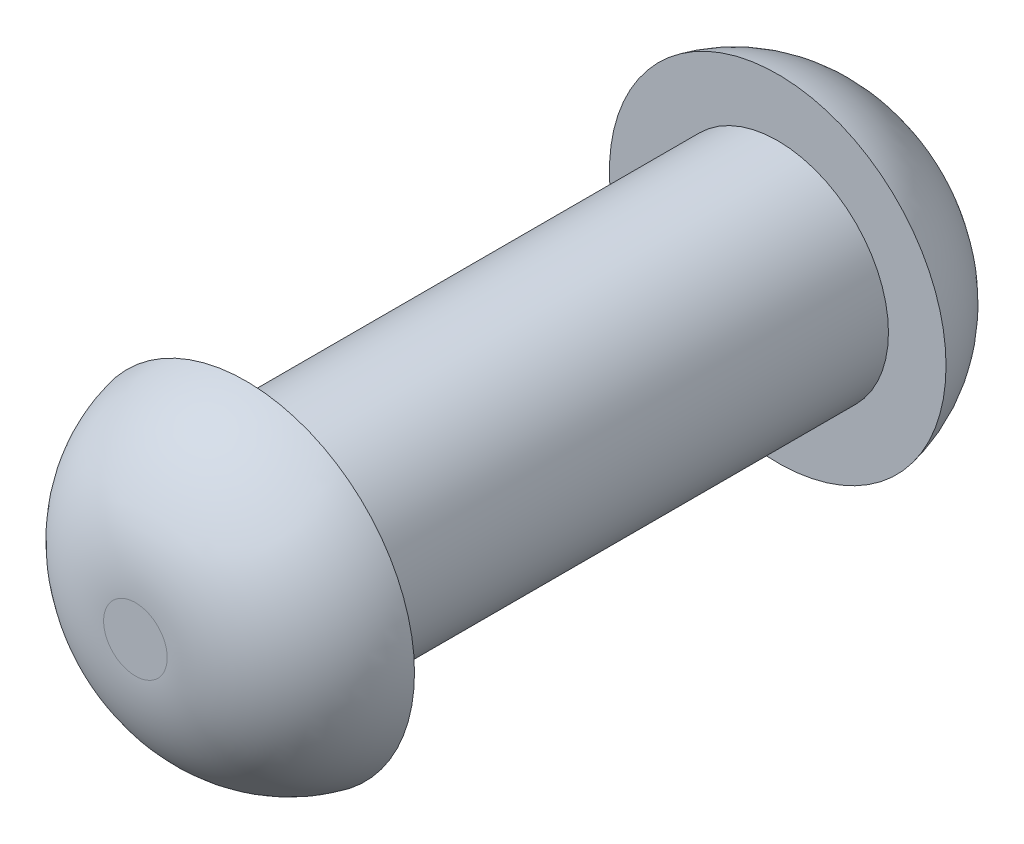
from build123d import *

# Parameters (mm, degrees)
CROQUIS1_R              = 1.5875
SALIENTE_EXTRUIR1_DEPTH = 3.81
CROQUIS2_R              = 2.413
SALIENTE_EXTRUIR2_DEPTH = 1.5875
REDONDEO1_R             = 2
REDONDEO2_R             = 2


with BuildPart() as part:
    # Croquis1 → Saliente-Extruir1 (new, symmetric)
    with BuildSketch(Plane.XY):
        with Locations(Location((0, 0, 0), (0, 0, 180))):
            Circle(CROQUIS1_R)
    extrude(amount=SALIENTE_EXTRUIR1_DEPTH, both=True)

    # Croquis2 → Saliente-Extruir2 (add)
    with BuildSketch(Plane.XY.offset(3.81)):
        Circle(CROQUIS2_R)
    saliente_extruir2 = extrude(amount=SALIENTE_EXTRUIR2_DEPTH)

    # Redondeo1
    # the kernel refuses this fillet: 2 mm, written as the material it takes off along each edge
    with BuildSketch(Plane(origin=(0, 0, 5.3975), x_dir=(1, 0, 0), z_dir=(0, -1, 0))) as redondeo1_piece_1:
        with BuildLine():
            CenterArc((0.456001341, -2), REDONDEO1_R, 11.902682649, 78.097317351)
            Line((0.456001341, 0), (0.456001341, 0.04))
            Line((0.456001341, 0.04), (2.413, 0.04))
            Line((2.413, 0.04), (2.453, 0))
            ThreePointArc((2.453, 0), (2.453, -0.79375), (2.452139973, -1.57925))
            Line((2.452139973, -1.57925), (2.413, -1.5875))
        make_face()
    revolve(axis=Axis((0, 0, 5.3975), (0, 0, 1)), mode=Mode.SUBTRACT)

    # Simetría4: Saliente-Extruir2 across plane
    add(saliente_extruir2.mirror(Plane.XY))

    # Redondeo2
    # the kernel refuses this fillet: 2 mm, written as the material it takes off along each edge
    with BuildSketch(Plane(origin=(0, 0, -5.3975), x_dir=(1, 0, 0), z_dir=(0, -1, 0))) as redondeo2_piece_1:
        with BuildLine():
            CenterArc((0.456001341, 2), REDONDEO2_R, 270, 78.097317351)
            Line((0.456001341, 0), (0.456001341, -0.04))
            Line((0.456001341, -0.04), (2.413, -0.04))
            Line((2.413, -0.04), (2.453, 0))
            ThreePointArc((2.453, 0), (2.453, 0.79375), (2.452139973, 1.57925))
            Line((2.452139973, 1.57925), (2.413, 1.5875))
        make_face()
    revolve(axis=Axis((0, 0, -5.3975), (0, 0, 1)), mode=Mode.SUBTRACT)


solid = part.part
